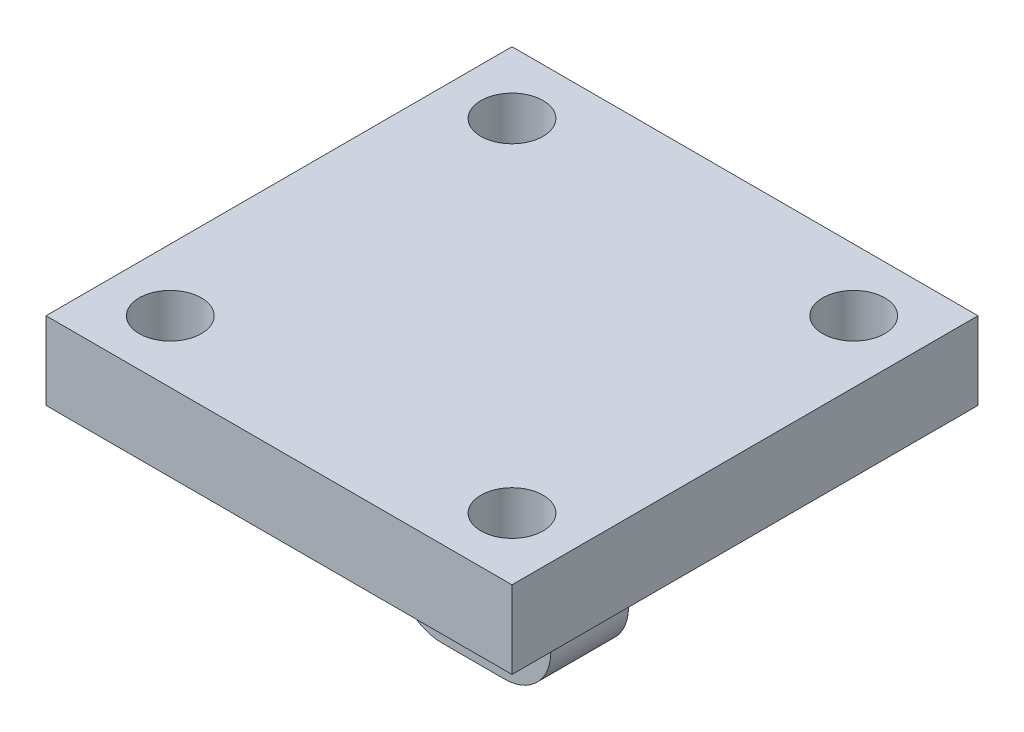
from build123d import *

# Parameters (mm, degrees)
SKETCH2_W           = 10
SKETCH2_H           = 18
SKETCH2_R           = 2
BOSS_EXTRUDE1_DEPTH = 5
SKETCH3_W           = 30
SKETCH3_H           = 30
BOSS_EXTRUDE2_DEPTH = 5
FILLET1_R           = 5
FILLET2_R           = 3
SKETCH4_R           = 2
CUT_EXTRUDE1_DEPTH  = 5


with BuildPart() as part:
    # Sketch2 → Boss-Extrude1 (new body)
    with BuildSketch(Plane.XY):
        with Locations((-5, 9)):
            Rectangle(SKETCH2_W, SKETCH2_H)
        with Locations((-5, 4.24)):
            Circle(SKETCH2_R, mode=Mode.SUBTRACT)
    extrude(amount=BOSS_EXTRUDE1_DEPTH)

    # Sketch3 → Boss-Extrude2 (add)
    with BuildSketch(Plane(origin=(0, 18, 0), x_dir=(1, 0, 0), z_dir=(0, 1, 0))):
        with Locations((-5, -2.5)):
            Rectangle(SKETCH3_W, SKETCH3_H)
    extrude(amount=-BOSS_EXTRUDE2_DEPTH)

    # Fillet1
    fillet1_edges = [part.edges().sort_by_distance(p)[0] for p in [
        (-10, 13, 2.5),
        (0, 13, 2.5),
    ]]
    fillet(fillet1_edges, radius=FILLET1_R)

    # Fillet2
    fillet2_edges = [part.edges().sort_by_distance(p)[0] for p in [
        (0, 0, 2.5),
        (-10, 0, 2.5),
    ]]
    fillet(fillet2_edges, radius=FILLET2_R)

    # Sketch4 → Cut-Extrude1 (cut)
    with BuildSketch(Plane(origin=(0, 18, 0), x_dir=(1, 0, 0), z_dir=(0, 1, 0))):
        with Locations((-16, 8.5)):
            Circle(SKETCH4_R)
        with Locations((6, 8.5)):
            Circle(SKETCH4_R)
        with Locations((6, -13.5)):
            Circle(SKETCH4_R)
        with Locations((-16, -13.5)):
            Circle(SKETCH4_R)
    extrude(amount=-CUT_EXTRUDE1_DEPTH, mode=Mode.SUBTRACT)


solid = part.part
